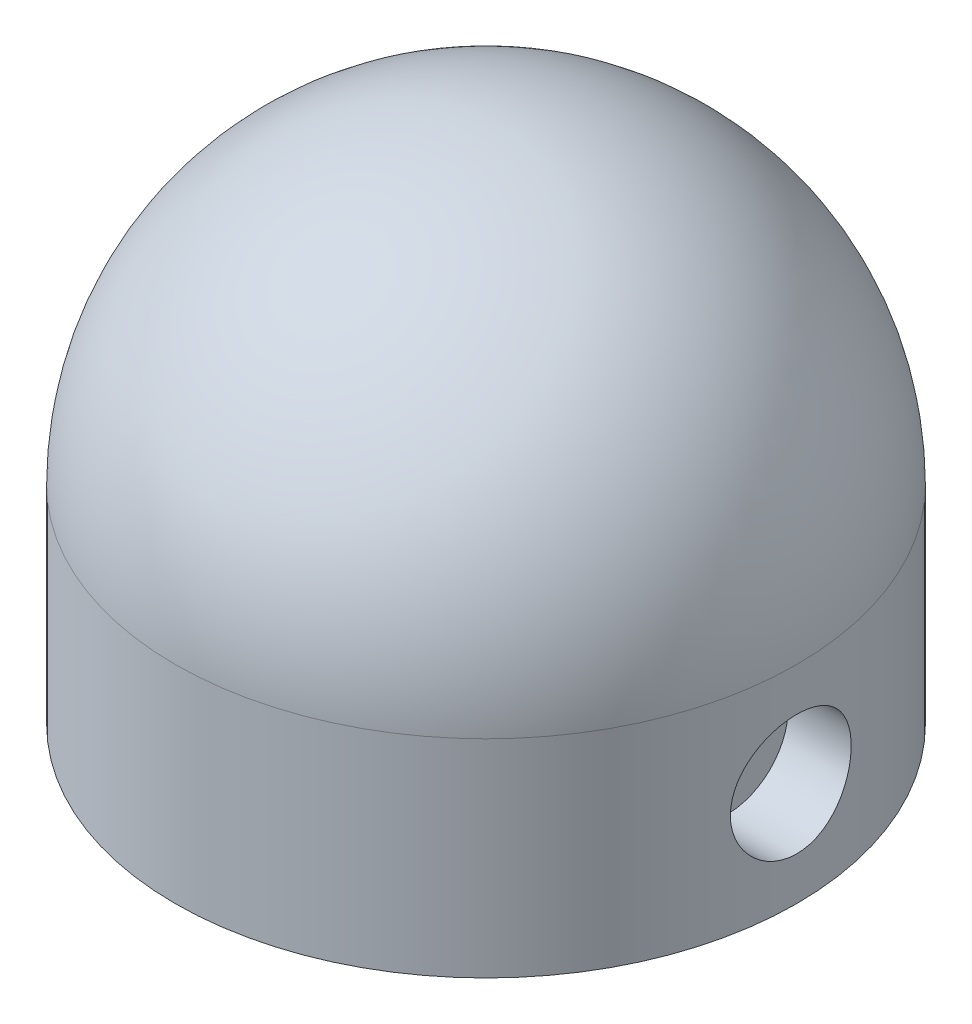
from build123d import *

# Parameters (mm, degrees)
SKETCH1_R               = 18
BOSS_EXTRUDE1_DEPTH     = 30
FILLET1_R               = 18
SKETCH2_W               = 10
SKETCH2_H               = 10
CUT_EXTRUDE1_DEPTH      = 25
CUT_EXTRUDE2_DEPTH      = 42.868842831
CUT_EXTRUDE2_DEPTH_BACK = 42.868842831
SKETCH3_R               = 1.6
CUT_EXTRUDE3_START      = -9
SKETCH4_R               = 3.5
CUT_EXTRUDE3_DEPTH      = 20
CUT_EXTRUDE4_START      = -8
CUT_EXTRUDE4_DEPTH      = 16


with BuildPart() as part:
    # Sketch1 → Boss-Extrude1 (new body)
    with BuildSketch(Plane(origin=(0, 0, 0), x_dir=(1, 0, 0), z_dir=(0, 1, 0))):
        Circle(SKETCH1_R)
    extrude(amount=BOSS_EXTRUDE1_DEPTH)

    # Fillet1
    fillet1_edges = [part.edges().sort_by_distance(p)[0] for p in [
        (-18, 30, 0),
    ]]
    fillet(fillet1_edges, radius=FILLET1_R)

    # Sketch2 → Cut-Extrude1 (cut)
    with BuildSketch(Plane.XZ):
        Rectangle(SKETCH2_W, SKETCH2_H)
    extrude(amount=-CUT_EXTRUDE1_DEPTH, mode=Mode.SUBTRACT)

    # Sketch3 → Cut-Extrude2 (cut, two sides: drawn at the far end of the back side and taken through both)
    with BuildSketch(Plane.ZY.offset(-5).offset(-CUT_EXTRUDE2_DEPTH_BACK)):
        with Locations((0, 6)):
            Circle(SKETCH3_R)
    extrude(amount=CUT_EXTRUDE2_DEPTH + CUT_EXTRUDE2_DEPTH_BACK, mode=Mode.SUBTRACT)

    # Sketch4 → Cut-Extrude3 (cut)
    with BuildSketch(Plane.ZY.offset(-5).offset(CUT_EXTRUDE3_START)):
        with Locations((0, 6)):
            Circle(SKETCH4_R)
    extrude(amount=-CUT_EXTRUDE3_DEPTH, mode=Mode.SUBTRACT)

    # Sketch5 → Cut-Extrude4 (cut)
    with BuildSketch(Plane(origin=(-5, 0, 0), x_dir=(0, 0, -1), z_dir=(1, 0, 0)).offset(CUT_EXTRUDE4_START)):
        Polygon((-2.814582562, 7.625), (-2.814582562, 4.375), (0, 2.75), (2.814582562, 4.375), (2.814582562, 7.625), (0, 9.25), align=None)
    extrude(amount=-CUT_EXTRUDE4_DEPTH, mode=Mode.SUBTRACT)


solid = part.part
